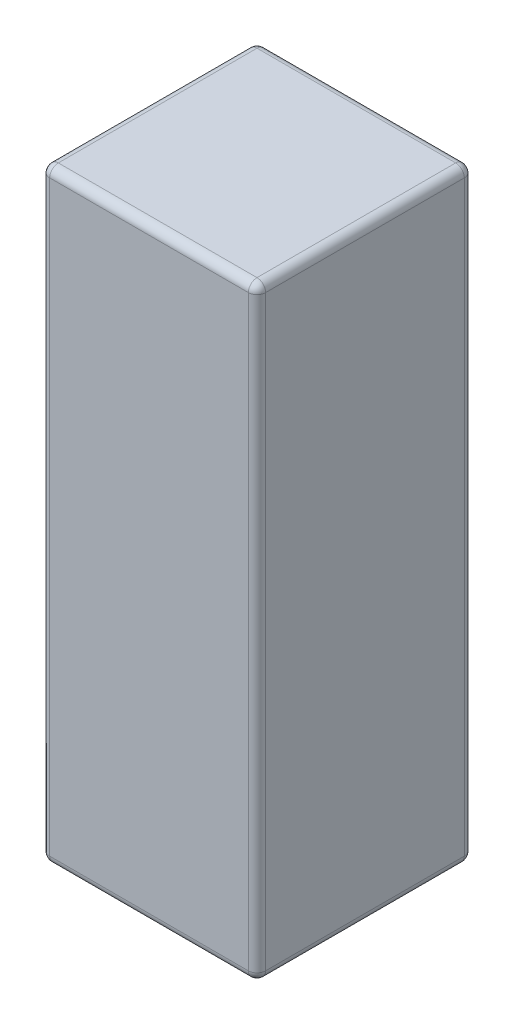
from build123d import *

# Parameters (mm, degrees)
SKETCH1_W           = 50
SKETCH1_H           = 50
BOSS_EXTRUDE1_DEPTH = 70
FILLET1_R           = 2
FILLET2_R           = 2


with BuildPart() as part:
    # Sketch1 → Boss-Extrude1 (new, symmetric)
    with BuildSketch(Plane(origin=(0, 0, 0), x_dir=(1, 0, 0), z_dir=(0, 1, 0))):
        Rectangle(SKETCH1_W, SKETCH1_H)
    extrude(amount=BOSS_EXTRUDE1_DEPTH, both=True)

    # Fillet1
    fillet1_edges = [part.edges().sort_by_distance(p)[0] for p in [
        (-25, 70, 0),
        (0, 70, 25),
        (25, 70, 0),
        (0, -70, 25),
        (-25, -70, 0),
        (0, -70, -25),
        (25, -70, 0),
        (0, 70, -25),
    ]]
    fillet(fillet1_edges, radius=FILLET1_R)

    # Fillet2
    # the kernel refuses this fillet: 2 mm, written as the material it takes off along each edge
    with BuildSketch(Plane(origin=(23, -68, 23), x_dir=(1, 0, 0), z_dir=(0, 0, 1))) as fillet2_piece_1_section:
        Polygon((0, 0), (FILLET2_R, 0), (FILLET2_R, -FILLET2_R), (0, -FILLET2_R), align=None)
    fillet2_piece_1 = extrude(amount=FILLET2_R, mode=Mode.PRIVATE)
    fillet2_piece_1 = fillet2_piece_1 - Plane(origin=(23, -68, 23), x_dir=(-0.7071067811865475, 0.7071067811865475, 0), z_dir=(0, 0, 1)) * Sphere(FILLET2_R, mode=Mode.PRIVATE)
    add(fillet2_piece_1, mode=Mode.SUBTRACT)
    with BuildSketch(Plane(origin=(-23, -68, 23), x_dir=(-1, 0, 0), z_dir=(0, 0, 1))) as fillet2_piece_2_section:
        Polygon((0, 0), (FILLET2_R, 0), (FILLET2_R, FILLET2_R), (0, FILLET2_R), align=None)
    fillet2_piece_2 = extrude(amount=FILLET2_R, mode=Mode.PRIVATE)
    fillet2_piece_2 = fillet2_piece_2 - Plane(origin=(-23, -68, 23), x_dir=(0.7071067811865475, 0.7071067811865475, 0), z_dir=(0, 0, 1)) * Sphere(FILLET2_R, mode=Mode.PRIVATE)
    add(fillet2_piece_2, mode=Mode.SUBTRACT)
    with BuildSketch(Plane(origin=(23, -68, -23), x_dir=(0, 0, -1), z_dir=(1, 0, 0))) as fillet2_piece_3_section:
        Polygon((0, 0), (FILLET2_R, 0), (FILLET2_R, -FILLET2_R), (0, -FILLET2_R), align=None)
    fillet2_piece_3 = extrude(amount=FILLET2_R, mode=Mode.PRIVATE)
    fillet2_piece_3 = fillet2_piece_3 - Plane(origin=(23, -68, -23), x_dir=(0, 0.7071067811865475, 0.7071067811865475), z_dir=(1, 0, 0)) * Sphere(FILLET2_R, mode=Mode.PRIVATE)
    add(fillet2_piece_3, mode=Mode.SUBTRACT)
    with BuildSketch(Plane(origin=(-23, -68, -23), x_dir=(0, 0, -1), z_dir=(-1, 0, 0))) as fillet2_piece_4_section:
        Polygon((0, 0), (FILLET2_R, 0), (FILLET2_R, FILLET2_R), (0, FILLET2_R), align=None)
    fillet2_piece_4 = extrude(amount=FILLET2_R, mode=Mode.PRIVATE)
    fillet2_piece_4 = fillet2_piece_4 - Plane(origin=(-23, -68, -23), x_dir=(0, 0.7071067811865475, 0.7071067811865475), z_dir=(-1, 0, 0)) * Sphere(FILLET2_R, mode=Mode.PRIVATE)
    add(fillet2_piece_4, mode=Mode.SUBTRACT)
    with BuildSketch(Plane(origin=(-23, 68, -23), x_dir=(0, 0, -1), z_dir=(-1, 0, 0))) as fillet2_piece_5_section:
        Polygon((0, 0), (FILLET2_R, 0), (FILLET2_R, -FILLET2_R), (0, -FILLET2_R), align=None)
    fillet2_piece_5 = extrude(amount=FILLET2_R, mode=Mode.PRIVATE)
    fillet2_piece_5 = fillet2_piece_5 - Plane(origin=(-23, 68, -23), x_dir=(0, -0.7071067811865475, 0.7071067811865475), z_dir=(-1, 0, 0)) * Sphere(FILLET2_R, mode=Mode.PRIVATE)
    add(fillet2_piece_5, mode=Mode.SUBTRACT)
    with BuildSketch(Plane(origin=(23, 68, -23), x_dir=(0, 0, -1), z_dir=(1, 0, 0))) as fillet2_piece_6_section:
        Polygon((0, 0), (FILLET2_R, 0), (FILLET2_R, FILLET2_R), (0, FILLET2_R), align=None)
    fillet2_piece_6 = extrude(amount=FILLET2_R, mode=Mode.PRIVATE)
    fillet2_piece_6 = fillet2_piece_6 - Plane(origin=(23, 68, -23), x_dir=(0, -0.7071067811865475, 0.7071067811865475), z_dir=(1, 0, 0)) * Sphere(FILLET2_R, mode=Mode.PRIVATE)
    add(fillet2_piece_6, mode=Mode.SUBTRACT)
    with BuildSketch(Plane(origin=(-23, 68, 23), x_dir=(-1, 0, 0), z_dir=(0, 0, 1))) as fillet2_piece_7_section:
        Polygon((0, 0), (FILLET2_R, 0), (FILLET2_R, -FILLET2_R), (0, -FILLET2_R), align=None)
    fillet2_piece_7 = extrude(amount=FILLET2_R, mode=Mode.PRIVATE)
    fillet2_piece_7 = fillet2_piece_7 - Plane(origin=(-23, 68, 23), x_dir=(0.7071067811865475, -0.7071067811865475, 0), z_dir=(0, 0, 1)) * Sphere(FILLET2_R, mode=Mode.PRIVATE)
    add(fillet2_piece_7, mode=Mode.SUBTRACT)
    with BuildSketch(Plane(origin=(23, 68, 23), x_dir=(1, 0, 0), z_dir=(0, 0, 1))) as fillet2_piece_8_section:
        Polygon((0, 0), (FILLET2_R, 0), (FILLET2_R, FILLET2_R), (0, FILLET2_R), align=None)
    fillet2_piece_8 = extrude(amount=FILLET2_R, mode=Mode.PRIVATE)
    fillet2_piece_8 = fillet2_piece_8 - Plane(origin=(23, 68, 23), x_dir=(-0.7071067811865475, -0.7071067811865475, 0), z_dir=(0, 0, 1)) * Sphere(FILLET2_R, mode=Mode.PRIVATE)
    add(fillet2_piece_8, mode=Mode.SUBTRACT)
    with BuildSketch(Plane(origin=(-25, 68, -25), x_dir=(0, 0, 1), z_dir=(0, -1, 0)), Plane(origin=(25, -68, -25), x_dir=(0, 0, 1), z_dir=(0, 1, 0)), Plane(origin=(-25, 68, 25), x_dir=(1, 0, 0), z_dir=(0, -1, 0)), Plane(origin=(25, -68, 25), x_dir=(-1, 0, 0), z_dir=(0, 1, 0))) as fillet2_piece_9:
        with BuildLine():
            CenterArc((FILLET2_R, -FILLET2_R), FILLET2_R, 90, 90)
            Line((0, -FILLET2_R), (0, 0))
            Line((0, 0), (FILLET2_R, 0))
        make_face()
    extrude(amount=136, mode=Mode.SUBTRACT)


solid = part.part
